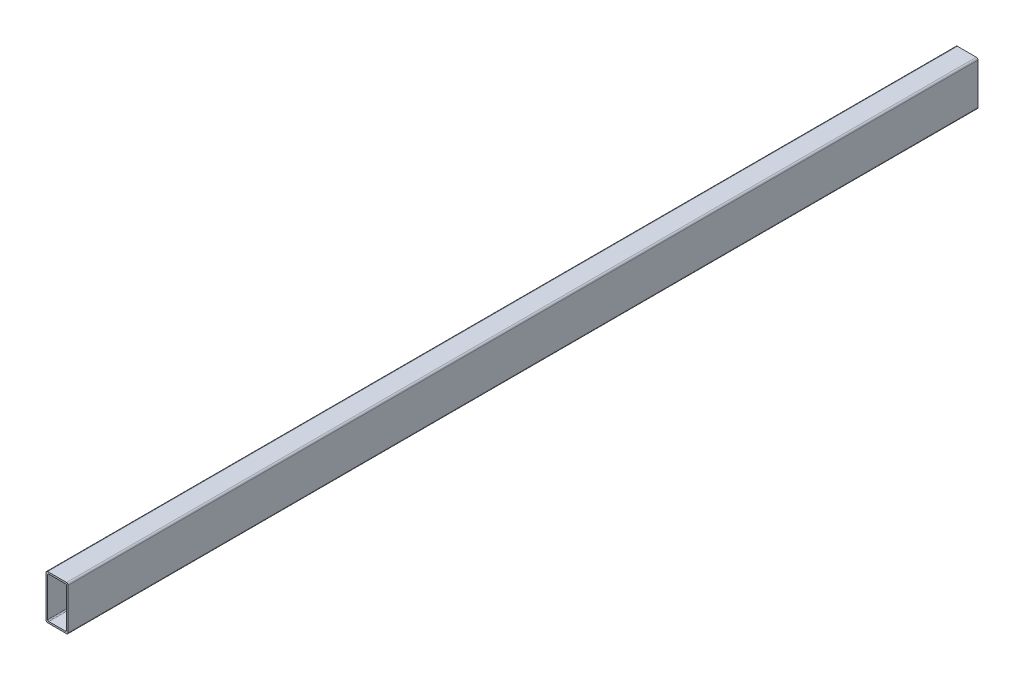
from build123d import *

# Parameters (mm, degrees)
EXTRUDE_START   = -410
EXTRUDE_1_DEPTH = 410


# Read off the part's stored shape, not the designer's step: Бобышка-Вытянуть1
with BuildPart() as part:
    # Бобышка-Вытянуть1 outline → Бобышка-Вытянуть1 (new body)
    with BuildSketch(Plane.XY.offset(EXTRUDE_START)):
        with BuildLine():
            ThreePointArc((-34.964986884, -38.5), (-34.525647056, -39.560660172), (-33.464986884, -40))
            Line((-33.464986884, -40), (-16.464986884, -40))
            ThreePointArc((-16.464986884, -40), (-15.404326712, -39.560660172), (-14.964986884, -38.5))
            Line((-14.964986884, -38.5), (-14.964986884, -1.5))
            ThreePointArc((-14.964986884, -1.5), (-15.404326712, -0.439339828), (-16.464986884, 0))
            Line((-16.464986884, 0), (-33.464986884, 0))
            ThreePointArc((-33.464986884, 0), (-34.525647056, -0.439339828), (-34.964986884, -1.5))
            Line((-34.964986884, -1.5), (-34.964986884, -38.5))
        make_face()
        with BuildLine():
            Line((-33.464986884, -37.5), (-33.464986884, -2.5))
            ThreePointArc((-33.464986884, -2.5), (-33.172093665, -1.792893219), (-32.464986884, -1.5))
            Line((-32.464986884, -1.5), (-17.464986884, -1.5))
            ThreePointArc((-17.464986884, -1.5), (-16.757880103, -1.792893219), (-16.464986884, -2.5))
            Line((-16.464986884, -2.5), (-16.464986884, -37.5))
            ThreePointArc((-16.464986884, -37.5), (-16.757880103, -38.207106781), (-17.464986884, -38.5))
            Line((-17.464986884, -38.5), (-32.464986884, -38.5))
            ThreePointArc((-32.464986884, -38.5), (-33.172093665, -38.207106781), (-33.464986884, -37.5))
        make_face(mode=Mode.SUBTRACT)
    extrude(amount=EXTRUDE_1_DEPTH)

    # Зеркальное отражение1: part across plane


with BuildPart() as part_1:
    add(part.part)
    add(part.part.mirror(Plane(origin=(441.299876816, -806.206552751, -410), x_dir=(1, 0, 0), z_dir=(0, 0, 1))))


solid = part_1.part
